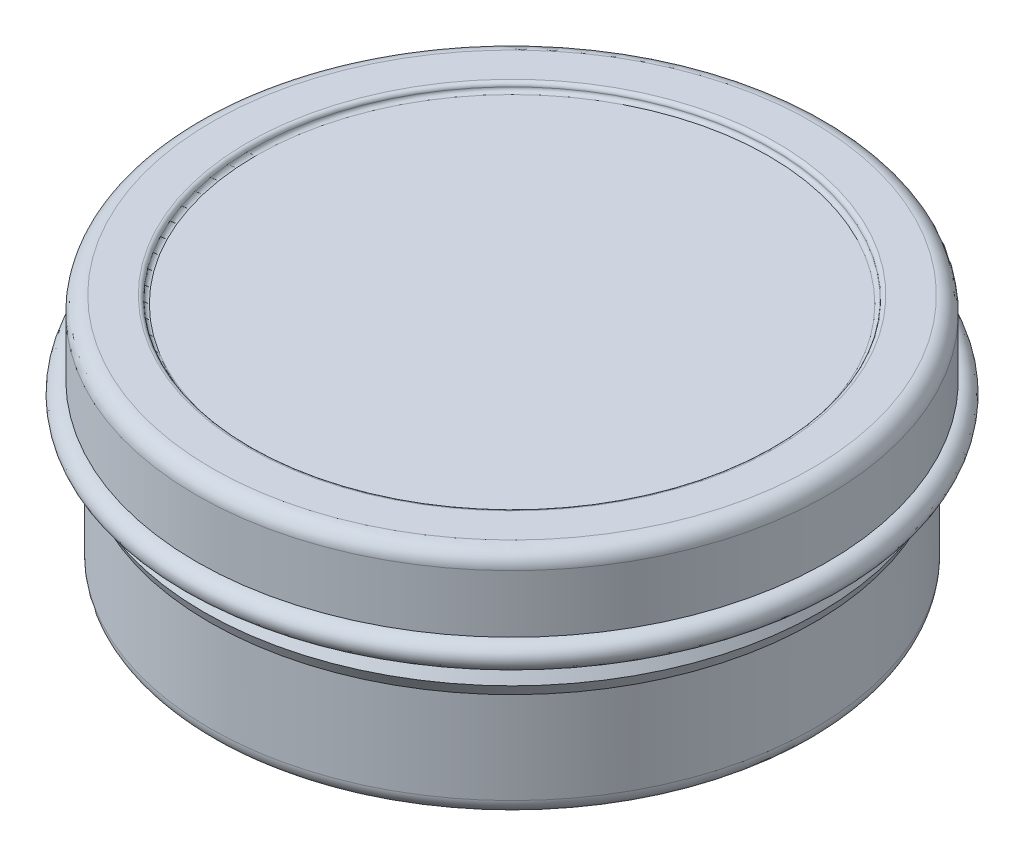
from build123d import *

# Parameters (mm, degrees)
SKETCH2_R          = 16.75
CUT_EXTRUDE1_DEPTH = 0.5
FILLET1_R          = 1
FILLET2_R          = 0.25


with BuildPart() as part:
    # Sketch1 → Revolve1 (revolve)
    with BuildSketch(Plane.XY, mode=Mode.PRIVATE) as revolve1_sk:
        with BuildLine():
            Line((0, 0), (-19.45, 0))
            Line((-19.45, 0), (-19.45, 6.9))
            Line((-19.45, 6.9), (-19.825, 7.657541722))
            Line((-19.825, 7.657541722), (-19.45, 8.415083444))
            Line((-19.45, 8.415083444), (-19.45, 9.1))
            Line((-19.45, 9.1), (-20.3, 9.1))
            add(Edge.make_bspline(
                [(-20.3, 10.7), (-21.2, 10.7), (-21.2, 9.9), (-21.2, 9.1), (-20.3, 9.1)],
                knots=[4.71238898, 4.71238898, 4.71238898, 6.283185307, 6.283185307, 7.853981634, 7.853981634, 7.853981634], degree=2, weights=[1, 0.707106781, 1, 0.707106781, 1]))
            Line((-20.3, 10.7), (-20.3, 15.41))
            Line((-20.3, 15.41), (0, 15.41))
            Line((0, 15.41), (0, 0))
        make_face()
    revolve(revolve1_sk.sketch.rotate(Axis((0, 24.52235385, 0), (0, -1, 0)), 270), axis=Axis((0, 24.52235385, 0), (0, -1, 0)))

    # Sketch2 → Cut-Extrude1 (cut)
    with BuildSketch(Plane(origin=(0, 15.41, 0), x_dir=(1, 0, 0), z_dir=(0, 1, 0))):
        with Locations(Location((0, 0, 0), (0, 0, 270))):
            Circle(SKETCH2_R)
    extrude(amount=-CUT_EXTRUDE1_DEPTH, mode=Mode.SUBTRACT)

    # Fillet1
    fillet1_edges = [part.edges().sort_by_distance(p)[0] for p in [
        (0, 15.41, -20.3),
        (0, 0, -19.45),
    ]]
    fillet(fillet1_edges, radius=FILLET1_R)

    # Fillet2
    fillet2_edges = [part.edges().sort_by_distance(p)[0] for p in [
        (0, 14.91, -16.75),
        (0, 15.41, -16.75),
    ]]
    fillet(fillet2_edges, radius=FILLET2_R - 0.0001)  # a hair under: the kernel refuses the full size


solid = part.part
